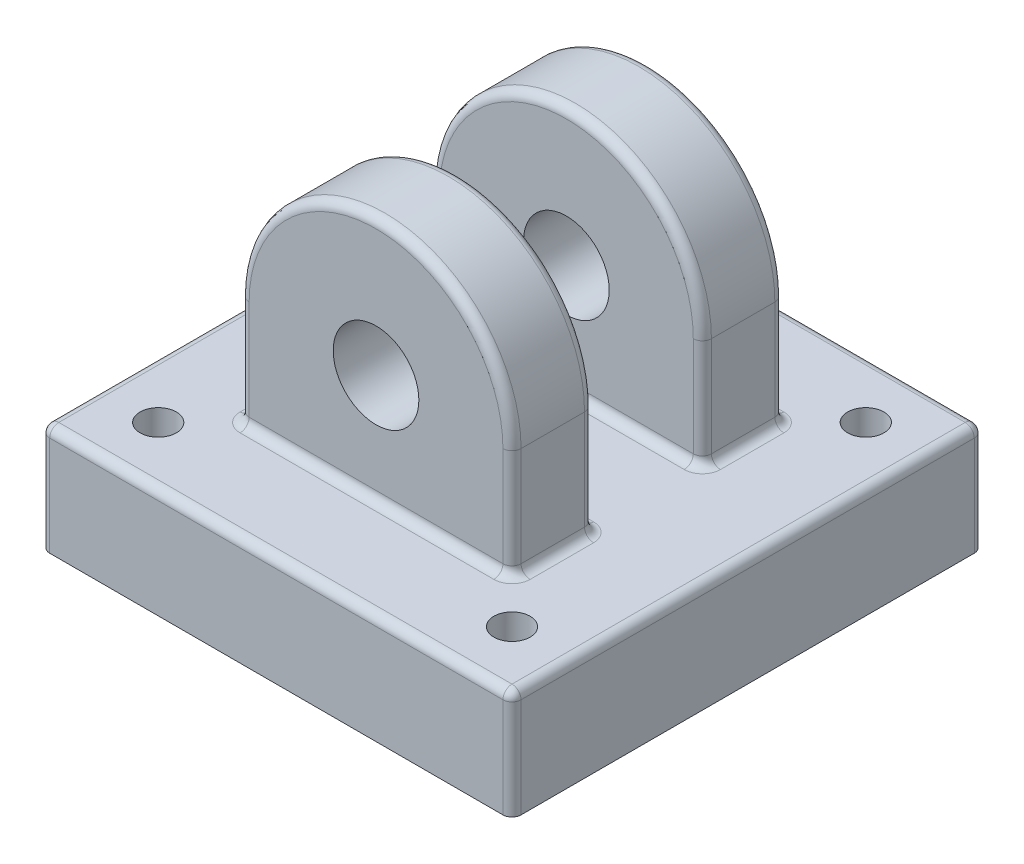
from build123d import *

# Parameters (mm, degrees)
SKETCH1_W                     = 165.1
SKETCH1_H                     = 38.1
BOSS_EXTRUDE1_DEPTH           = 82.55
BOSS_EXTRUDE2_START           = 19.05
SKETCH1_3_R                   = 15
BOSS_EXTRUDE2_DEPTH           = 28.575
BOSS_EXTRUDE3_START           = -47.625
SKETCH1_5_R                   = 15
BOSS_EXTRUDE3_DEPTH           = 28.575
SKETCH2_R                     = 26
CUT_EXTRUDE1_DEPTH            = 36.83
SKETCH2_3_R                   = 76.2
SKETCH2_3_R_2                 = 69.85
CUT_EXTRUDE2_DEPTH            = 8
M14X2_0_TAPPED_HOLE1_REACH    = 224.273
M14X2_0_TAPPED_HOLE1_BORE_R   = 6
F_1_0MM_DOWEL_HOLE1_OUTLINE_R = 6.35
F_1_0MM_DOWEL_HOLE1_DEPTH     = 20.05
F_1_0MM_DOWEL_HOLE2_D         = 12.7
FILLET1_R                     = 3.175
FILLET2_R                     = 3.175


# Read off the part's stored shape, not the designer's step: Ø1.0mm Dowel Hole1
with BuildPart() as part:
    # Sketch1 → Boss-Extrude1 (new, symmetric)
    with BuildSketch(Plane.XY):
        with Locations((0, 19.05)):
            Rectangle(SKETCH1_W, SKETCH1_H)
    extrude(amount=BOSS_EXTRUDE1_DEPTH, both=True)

    # Sketch1<3> → Boss-Extrude2 (add)
    with BuildSketch(Plane.XY.offset(BOSS_EXTRUDE2_START)):
        with BuildLine():
            Line((-47.625, 76.2), (-47.625, 38.1))
            Line((-47.625, 38.1), (47.625, 38.1))
            Line((47.625, 38.1), (47.625, 76.2))
            ThreePointArc((47.625, 76.2), (0, 123.825), (-47.625, 76.2))
        make_face()
        with Locations((0, 76.2)):
            Circle(SKETCH1_3_R, mode=Mode.SUBTRACT)
    extrude(amount=BOSS_EXTRUDE2_DEPTH)

    # Sketch1<5> → Boss-Extrude3 (add)
    with BuildSketch(Plane.XY.offset(BOSS_EXTRUDE3_START)):
        with BuildLine():
            Line((-47.625, 76.2), (-47.625, 38.1))
            Line((-47.625, 38.1), (47.625, 38.1))
            Line((47.625, 38.1), (47.625, 76.2))
            ThreePointArc((47.625, 76.2), (0, 123.825), (-47.625, 76.2))
        make_face()
        with Locations((0, 76.2)):
            Circle(SKETCH1_5_R, mode=Mode.SUBTRACT)
    extrude(amount=BOSS_EXTRUDE3_DEPTH)

    # Sketch2 → Cut-Extrude1 (cut)
    with BuildSketch(Plane.XZ):
        Circle(SKETCH2_R)
    extrude(amount=-CUT_EXTRUDE1_DEPTH, mode=Mode.SUBTRACT)

    # Sketch2<3> → Cut-Extrude2 (cut)
    with BuildSketch(Plane.XZ):
        Circle(SKETCH2_3_R)
        Circle(SKETCH2_3_R_2, mode=Mode.SUBTRACT)
    extrude(amount=-CUT_EXTRUDE2_DEPTH, mode=Mode.SUBTRACT)

    # M14x2.0 Tapped Hole1 bore → M14x2.0 Tapped Hole1 (cut, up to next)
    with BuildSketch(Plane.ZY.offset(82.55), mode=Mode.PRIVATE) as m14x2_0_tapped_hole1_sk1:
        with Locations((0, 20.05)):
            Circle(M14X2_0_TAPPED_HOLE1_BORE_R)
    m14x2_0_tapped_hole1_tool1 = extrude(m14x2_0_tapped_hole1_sk1.sketch, amount=-M14X2_0_TAPPED_HOLE1_REACH, mode=Mode.PRIVATE) & part.part
    add(m14x2_0_tapped_hole1_tool1.solids().sort_by_distance((-82.55, 20.05, 0))[0], mode=Mode.SUBTRACT)

    # Ø1.0mm Dowel Hole1 outline → Ø1.0mm Dowel Hole1 (cut)
    with BuildSketch(Plane(origin=(0, 0, 0), x_dir=(1, 0, 0), z_dir=(0, 1, 0))):
        with Locations((-50.55, 0)):
            Circle(F_1_0MM_DOWEL_HOLE1_OUTLINE_R)
    extrude(amount=F_1_0MM_DOWEL_HOLE1_DEPTH, mode=Mode.SUBTRACT)

    # Ø1.0mm Dowel Hole2 (through all)
    with Locations(Plane(origin=(0, 38.1, 0), x_dir=(1, 0, 0), z_dir=(0, 1, 0))):
        with Locations((-61.963767235, 61.963767235), (61.963767235, -61.963767235), (-61.963767235, -61.963767235), (61.963767235, 61.963767235)):
            Hole(F_1_0MM_DOWEL_HOLE2_D / 2)

    # Fillet1
    fillet1_edges = [part.edges().sort_by_distance(p)[0] for p in [
        (82.55, 19.05, 82.55),
        (-82.55, 19.05, 82.55),
        (82.55, 19.05, -82.55),
        (-82.55, 19.05, -82.55),
    ]]
    fillet(fillet1_edges, radius=FILLET1_R)

    # Fillet2
    fillet2_edges = [part.edges().sort_by_distance(p)[0] for p in [
        (0, 38.1, -82.55),
        (82.55, 38.1, 0),
        (-82.55, 38.1, 0),
        (0, 38.1, 82.55),
        (-81.62006403, 38.1, 81.62006403),
        (81.62006403, 38.1, 81.62006403),
        (-81.62006403, 38.1, -81.62006403),
        (81.62006403, 38.1, -81.62006403),
        (0, 123.825, 47.625),
        (-47.625, 57.15, 47.625),
        (0, 38.1, 19.05),
        (-47.625, 38.1, 33.3375),
        (47.625, 57.15, 47.625),
        (47.625, 38.1, 33.3375),
        (0, 38.1, 47.625),
        (0, 123.825, 19.05),
        (47.625, 57.15, 19.05),
        (-47.625, 57.15, 19.05),
        (0, 123.825, -19.05),
        (47.625, 57.15, -19.05),
        (0, 38.1, -47.625),
        (47.625, 38.1, -33.3375),
        (-47.625, 57.15, -19.05),
        (-47.625, 38.1, -33.3375),
        (0, 123.825, -47.625),
        (47.625, 57.15, -47.625),
        (-47.625, 57.15, -47.625),
        (0, 38.1, -19.05),
    ]]
    fillet(fillet2_edges, radius=FILLET2_R)


solid = part.part
